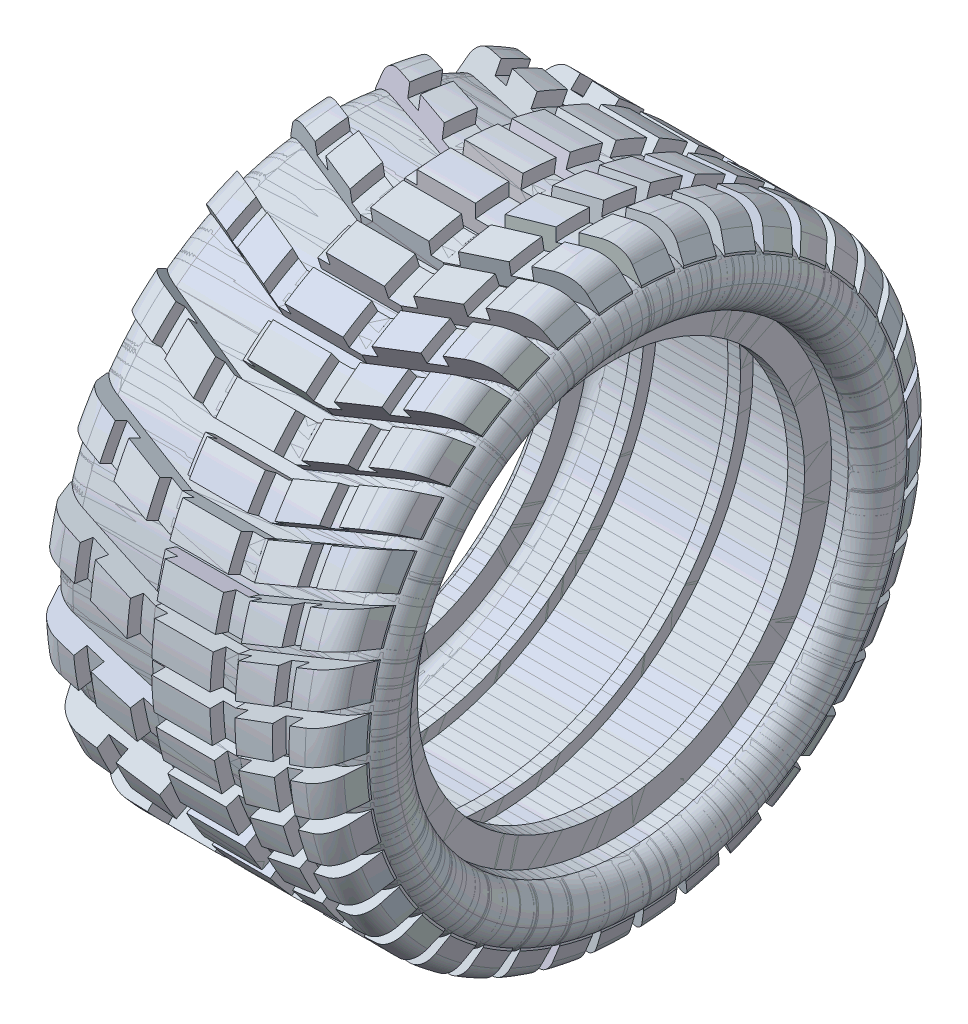
from build123d import *

# Parameters (mm, degrees)
BOSS_EXTRUDE1_REACH   = 99.036
CIRPATTERN1_COUNT     = 20
BODY_MOVE_COPY1_ANGLE = 9


with BuildPart() as part:
    # Sketch1 → Revolve1 (revolve)
    with BuildSketch(Plane.XY, mode=Mode.PRIVATE) as revolve1_sk:
        with BuildLine():
            Line((-30.5, 25.5), (-30.5, 23.25))
            Line((-30.5, 23.25), (-32.5, 23.25))
            Line((-32.5, 23.25), (-32.5, 26.5))
            Line((-32.5, 26.5), (-34.5, 26.5))
            ThreePointArc((-34.5, 26.5), (-36.686729039, 30.480939803), (-33.186729039, 33.37570501))
            Line((-33.186729039, 33.37570501), (-1.313270961, 33.37570501))
            ThreePointArc((-1.313270961, 33.37570501), (2.186729039, 30.480939803), (0, 26.5))
            Line((0, 26.5), (-2, 26.5))
            Line((-2, 26.5), (-2, 23.25))
            Line((-2, 23.25), (-4, 23.25))
            Line((-4, 23.25), (-4, 25.5))
            Line((-4, 25.5), (-4, 25.927842744))
            Line((-4, 25.927842744), (-1.878679656, 28.049163087))
            Line((-1.878679656, 28.049163087), (-1.313270961, 28.049163087))
            ThreePointArc((-1.313270961, 28.049163087), (0.45, 29.812434049), (-1.313270961, 31.57570501))
            Line((-1.313270961, 31.57570501), (-5, 31.57570501))
            Line((-5, 31.57570501), (-5, 30.07570501))
            Line((-5, 30.07570501), (-6.5, 30.07570501))
            Line((-6.5, 30.07570501), (-6.5, 31.57570501))
            Line((-6.5, 31.57570501), (-16.5, 31.57570501))
            Line((-16.5, 31.57570501), (-16.5, 30.07570501))
            Line((-16.5, 30.07570501), (-18, 30.07570501))
            Line((-18, 30.07570501), (-18, 31.57570501))
            Line((-18, 31.57570501), (-28, 31.57570501))
            Line((-28, 31.57570501), (-28, 30.07570501))
            Line((-28, 30.07570501), (-29.5, 30.07570501))
            Line((-29.5, 30.07570501), (-29.5, 31.57570501))
            Line((-29.5, 31.57570501), (-33.186729039, 31.57570501))
            ThreePointArc((-33.186729039, 31.57570501), (-34.95, 29.812434049), (-33.186729039, 28.049163087))
            Line((-33.186729039, 28.049163087), (-32.621320344, 28.049163087))
            Line((-32.621320344, 28.049163087), (-30.5, 25.927842744))
            Line((-30.5, 25.927842744), (-30.5, 25.5))
        make_face()
    revolve(revolve1_sk.sketch.rotate(Axis((0, 0, 0), (-1, 0, 0)), 90), axis=Axis((0, 0, 0), (-1, 0, 0)))

    # Sketch3 → Boss-Extrude1 (add, up to next)
    with BuildSketch(Plane(origin=(0, 50, 0), x_dir=(-1, 0, 0), z_dir=(0, 1, 0)), mode=Mode.PRIVATE) as boss_extrude1_sk1:
        Polygon((22.25, 4.5), (12.25, 4.5), (-1.25, -0.413598163), (-1.25, -4.413598163), (12.25, 0.5), (22.25, 0.5), align=None)
    boss_extrude1_tool1 = extrude(boss_extrude1_sk1.sketch, amount=-BOSS_EXTRUDE1_REACH, mode=Mode.PRIVATE) - part.part
    boss_extrude1 = boss_extrude1_tool1.solids().sort_by_distance((-10.5, 50, 1.088647))[0]
    add(boss_extrude1)

    # CirPattern1: Boss-Extrude1 ×20 about axis
    cirpattern1_axis = Axis((0, 0, 0), (1, 0, 0))
    for i in range(1, CIRPATTERN1_COUNT):
        add(boss_extrude1.rotate(cirpattern1_axis, i * 360 / CIRPATTERN1_COUNT))

    # Sketch4 → Cut-Revolve2 (revolve, cut)
    with BuildSketch(Plane.XY, mode=Mode.PRIVATE) as cut_revolve2_sk:
        with BuildLine():
            Line((-35.95, 32.062152595), (-34.95, 34.507499115))
            ThreePointArc((-34.95, 34.507499115), (-33.845543211, 35.862603921), (-32.173212302, 36.37195956))
            Line((-32.173212302, 36.37195956), (-30.25, 36.37195956))
            Line((-30.25, 36.37195956), (-30.25, 34.77195956))
            Line((-30.25, 34.77195956), (-28.25, 34.77195956))
            Line((-28.25, 34.77195956), (-28.25, 36.37195956))
            Line((-28.25, 36.37195956), (-23.75, 36.37195956))
            Line((-23.75, 36.37195956), (-23.75, 34.77195956))
            Line((-23.75, 34.77195956), (-20.75, 34.77195956))
            Line((-20.75, 34.77195956), (-20.75, 36.37195956))
            Line((-20.75, 36.37195956), (-13.75, 36.37195956))
            Line((-13.75, 36.37195956), (-13.75, 34.77195956))
            Line((-13.75, 34.77195956), (-10.75, 34.77195956))
            Line((-10.75, 34.77195956), (-10.75, 36.37195956))
            Line((-10.75, 36.37195956), (-6.25, 36.37195956))
            Line((-6.25, 36.37195956), (-6.25, 34.77195956))
            Line((-6.25, 34.77195956), (-4.25, 34.77195956))
            Line((-4.25, 34.77195956), (-4.25, 36.37195956))
            Line((-4.25, 36.37195956), (-2.326787698, 36.37195956))
            ThreePointArc((-2.326787698, 36.37195956), (-0.654456789, 35.862603921), (0.45, 34.507499115))
            Line((0.45, 34.507499115), (1.45, 32.062152595))
            Line((1.45, 32.062152595), (9.429049566, 56.504469474))
            Line((9.429049566, 56.504469474), (-43.929049566, 56.504469474))
            Line((-43.929049566, 56.504469474), (-35.95, 32.062152595))
        make_face()
    revolve(cut_revolve2_sk.sketch.rotate(Axis((-1.313270961, 0, 0), (-1, 0, 0)), 90), axis=Axis((-1.313270961, 0, 0), (-1, 0, 0)), mode=Mode.SUBTRACT)


with BuildPart() as body_2:
    # Body-Move/Copy1: copy of part
    add(part.part.rotate(Axis((0, 0, 0), (1, 0, 0)), BODY_MOVE_COPY1_ANGLE))


with BuildPart() as body_3:
    # Mirror2: mirrored copy
    add(body_2.part.mirror(Plane.ZY.offset(17.25)))


with BuildPart() as part_1:
    add(part.part)

    # Combine1: union body 3
    add(body_3.part)


solid = Compound([body_2.part, part_1.part])
